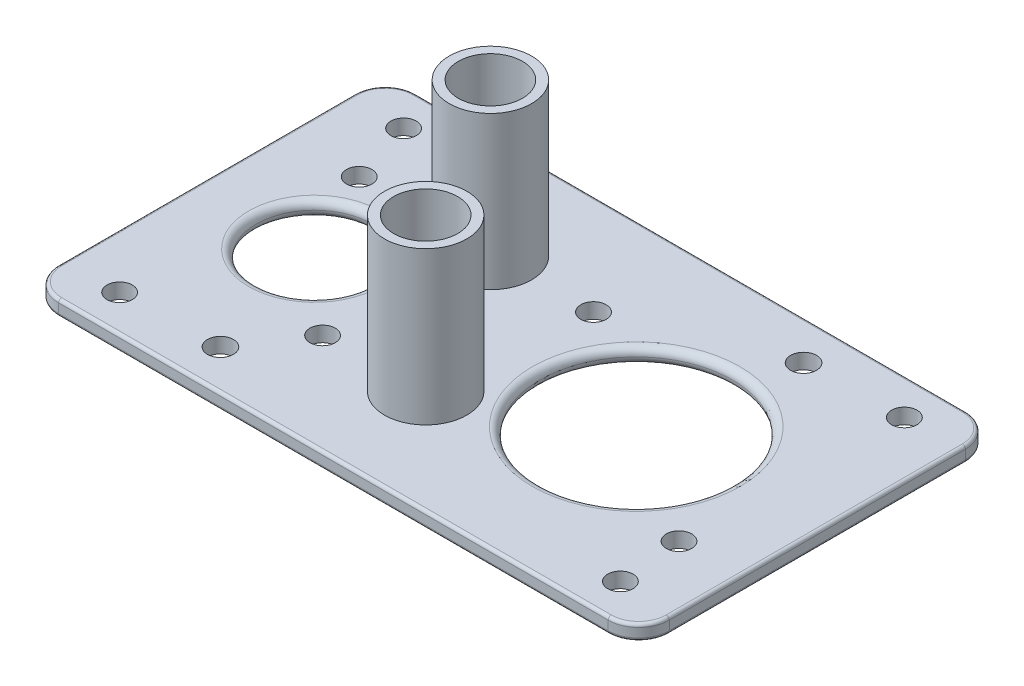
from build123d import *

# Parameters (mm, degrees)
SKETCH1_W           = 200
SKETCH1_H           = 117
SKETCH1_R           = 4.15
SKETCH1_R_2         = 4.25
SKETCH1_R_3         = 10
BOSS_EXTRUDE1_DEPTH = 2.5
SKETCH3_R           = 13.5
SKETCH3_R_2         = 10.5
BOSS_EXTRUDE3_DEPTH = 50
SKETCH4_R           = 10.5
SKETCH4_R_2         = 8.5
BOSS_EXTRUDE4_DEPTH = 25
FILLET1_R           = 10
FILLET2_R           = 1
SKETCH5_R           = 19
SKETCH5_R_2         = 31.5
CUT_EXTRUDE3_DEPTH  = 123
FILLET4_R           = 2.5


with BuildPart() as part:
    # Sketch1 → Boss-Extrude1 (new, symmetric)
    with BuildSketch(Plane(origin=(0, 0, 0), x_dir=(1, 0, 0), z_dir=(0, 1, 0))):
        with Locations((100, 58.5)):
            Rectangle(SKETCH1_W, SKETCH1_H)
        with Locations(Location((18, 105, 0), (0, 0, 270))):
            Circle(SKETCH1_R, mode=Mode.SUBTRACT)
        with Locations(Location((18, 12, 0), (0, 0, 270))):
            Circle(SKETCH1_R, mode=Mode.SUBTRACT)
        with Locations(Location((182, 105, 0), (0, 0, 270))):
            Circle(SKETCH1_R, mode=Mode.SUBTRACT)
        with Locations(Location((182, 12, 0), (0, 0, 270))):
            Circle(SKETCH1_R, mode=Mode.SUBTRACT)
        with Locations(Location((24.46757137, 84, 0), (0, 0, 270))):
            Circle(SKETCH1_R, mode=Mode.SUBTRACT)
        with Locations(Location((63.46757137, 33, 0), (0, 0, 270))):
            Circle(SKETCH1_R, mode=Mode.SUBTRACT)
        with Locations(Location((101.1891021, 84, 0), (0, 0, 270))):
            Circle(SKETCH1_R, mode=Mode.SUBTRACT)
        with Locations(Location((180.1891021, 33, 0), (0, 0, 270))):
            Circle(SKETCH1_R, mode=Mode.SUBTRACT)
        with Locations(Location((50, 13.015, 0), (0, 0, 270))):
            Circle(SKETCH1_R_2, mode=Mode.SUBTRACT)
        with Locations(Location((150, 103.985, 0), (0, 0, 270))):
            Circle(SKETCH1_R_2, mode=Mode.SUBTRACT)
        with Locations(Location((68.44757137, 82.98, 0), (0, 0, 270))):
            Circle(SKETCH1_R_3, mode=Mode.SUBTRACT)
        with Locations(Location((96.2091021, 34.02, 0), (0, 0, 270))):
            Circle(SKETCH1_R_3, mode=Mode.SUBTRACT)
    extrude(amount=BOSS_EXTRUDE1_DEPTH, both=True)

    # Sketch3 → Boss-Extrude3 (add)
    # profile 1 of 2: a face of its own
    with BuildSketch(Plane(origin=(0, 2.5, 0), x_dir=(1, 0, 0), z_dir=(0, 1, 0))):
        with Locations(Location((68.44757137, 82.98, 0), (0, 0, 270))):
            Circle(SKETCH3_R)
        with Locations(Location((68.44757137, 82.98, 0), (0, 0, 270))):
            Circle(SKETCH3_R_2, mode=Mode.SUBTRACT)
    # profile 2 of 2: a face of its own
    with BuildSketch(Plane(origin=(0, 2.5, 0), x_dir=(1, 0, 0), z_dir=(0, 1, 0))):
        with Locations(Location((96.2091021, 34.02, 0), (0, 0, 270))):
            Circle(SKETCH3_R)
        with Locations(Location((96.2091021, 34.02, 0), (0, 0, 270))):
            Circle(SKETCH3_R_2, mode=Mode.SUBTRACT)
    extrude(amount=BOSS_EXTRUDE3_DEPTH)

    # Sketch4 → Boss-Extrude4 (add)
    # profile 1 of 2: a face of its own
    with BuildSketch(Plane(origin=(0, 2.5, 0), x_dir=(1, 0, 0), z_dir=(0, 1, 0))):
        with Locations(Location((68.44757137, 82.98, 0), (0, 0, 270))):
            Circle(SKETCH4_R)
        with Locations(Location((68.44757137, 82.98, 0), (0, 0, 270))):
            Circle(SKETCH4_R_2, mode=Mode.SUBTRACT)
    # profile 2 of 2: a face of its own
    with BuildSketch(Plane(origin=(0, 2.5, 0), x_dir=(1, 0, 0), z_dir=(0, 1, 0))):
        with Locations(Location((96.2091021, 34.02, 0), (0, 0, 270))):
            Circle(SKETCH4_R)
        with Locations(Location((96.2091021, 34.02, 0), (0, 0, 270))):
            Circle(SKETCH4_R_2, mode=Mode.SUBTRACT)
    extrude(amount=BOSS_EXTRUDE4_DEPTH)

    # Fillet1
    fillet1_edges = [part.edges().sort_by_distance(p)[0] for p in [
        (0, 0, -117),
        (0, 0, 0),
        (200, 0, 0),
        (200, 0, -117),
    ]]
    fillet(fillet1_edges, radius=FILLET1_R)

    # Fillet2
    fillet2_edges = [part.edges().sort_by_distance(p)[0] for p in [
        (197.071067812, -2.5, -2.928932188),
        (197.071067812, -2.5, -114.071067812),
        (2.928932188, -2.5, -114.071067812),
        (2.928932188, -2.5, -2.928932188),
        (0, 2.5, -58.5),
        (100, 2.5, -117),
        (200, 2.5, -58.5),
        (197.071067812, 2.5, -2.928932188),
        (197.071067812, 2.5, -114.071067812),
        (2.928932188, 2.5, -114.071067812),
        (2.928932188, 2.5, -2.928932188),
        (100, -2.5, 0),
        (100, 2.5, 0),
        (100, -2.5, -117),
        (200, -2.5, -58.5),
        (0, -2.5, -58.5),
    ]]
    fillet(fillet2_edges, radius=FILLET2_R)

    # Sketch5 → Cut-Extrude3 (cut)
    with BuildSketch(Plane(origin=(0, 2.5, 0), x_dir=(1, 0, 0), z_dir=(0, 1, 0))):
        with Locations(Location((37.540951665, 56.246198102, 0), (0, 0, 270))):
            Circle(SKETCH5_R)
        with Locations(Location((140.6891021, 58.5, 0), (0, 0, 270))):
            Circle(SKETCH5_R_2)
    extrude(amount=-CUT_EXTRUDE3_DEPTH, mode=Mode.SUBTRACT)

    # Fillet4
    fillet4_edges = [part.edges().sort_by_distance(p)[0] for p in [
        (37.540951665, -2.5, -75.246198102),
        (37.540951665, 2.5, -75.246198102),
        (140.6891021, -2.5, -90),
        (140.6891021, 2.5, -90),
    ]]
    fillet(fillet4_edges, radius=FILLET4_R - 0.0001)  # a hair under: the kernel refuses the full size


solid = part.part
